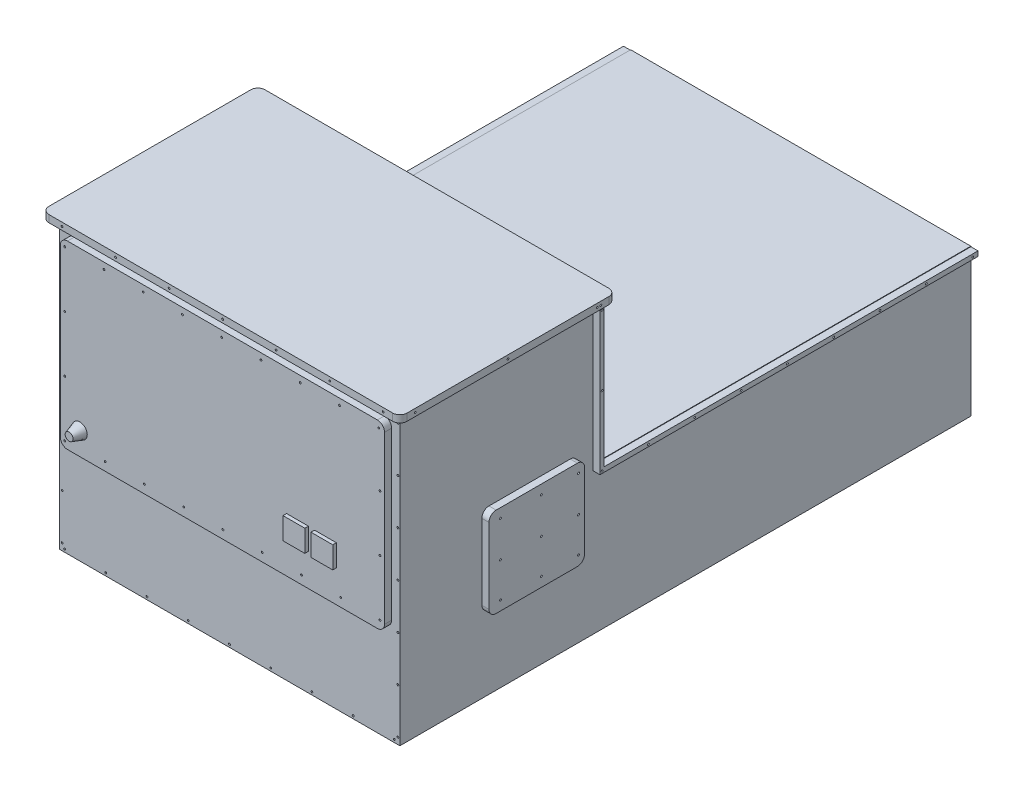
from build123d import *

# Parameters (mm, degrees)
SKETCH1_W                      = 95.34026147
SKETCH1_H                      = 41.254685336
BOSS_EXTRUDE1_DEPTH            = 160
SKETCH2_W                      = 95.34026147
SKETCH2_H                      = 55.558780076
BOSS_EXTRUDE2_DEPTH            = 40
BOSS_EXTRUDE3_DEPTH            = 2
LPATTERN1_COUNT                = 3
LPATTERN1_PITCH                = 19.5
LPATTERN1_COUNT_DIR2           = 10
LPATTERN1_PITCH_DIR2           = 12.98
F_0_80_TAPPED_HOLE3_AT_2_COUNT = 2
F_0_80_TAPPED_HOLE3_AT_2_PITCH = 19.810011741
F_0_80_TAPPED_HOLE3_AT_3_COUNT = 2
F_0_80_TAPPED_HOLE3_AT_3_PITCH = 22.382077827
F_0_80_TAPPED_HOLE3_AT_4_COUNT = 2
F_0_80_TAPPED_HOLE3_AT_4_PITCH = 29.500281021
F_0_80_TAPPED_HOLE3_AT_5_COUNT = 2
F_0_80_TAPPED_HOLE3_AT_5_PITCH = 24.069719456
F_0_80_TAPPED_HOLE3_AT_6_COUNT = 2
F_0_80_TAPPED_HOLE3_AT_6_PITCH = 21.8593233
F_0_80_TAPPED_HOLE3_AT_7_COUNT = 2
F_0_80_TAPPED_HOLE3_AT_7_PITCH = 14.492833478
F_0_80_TAPPED_HOLE3_AT_8_COUNT = 2
F_0_80_TAPPED_HOLE3_AT_8_PITCH = 10.075781834
F_0_80_TAPPED_HOLE3_AT_9_COUNT = 2
F_0_80_TAPPED_HOLE3_AT_9_PITCH = 10.41733376
BOSS_EXTRUDE4_DEPTH            = 1
BOSS_EXTRUDE4_DEPTH_BACK       = 1
LPATTERN2_COUNT                = 3
LPATTERN2_PITCH                = 26
LPATTERN3_COUNT                = 7
LPATTERN3_PITCH                = 15
LPATTERN5_COUNT                = 9
LPATTERN5_PITCH                = 11.55
LPATTERN6_COUNT                = 7
LPATTERN6_PITCH                = 12.7
LPATTERN7_COUNT                = 7
LPATTERN7_PITCH                = 12.7
BOSS_EXTRUDE5_DEPTH            = 2
LPATTERN8_COUNT                = 4
LPATTERN8_PITCH                = 15.7
LPATTERN8_COL_COUNT            = 9
LPATTERN8_COL_PITCH            = 11
LPATTERN10_COUNT               = 3
LPATTERN10_PITCH               = 15.7
LPATTERN10_COL_COUNT           = 8
LPATTERN10_COL_PITCH           = 11
LPATTERN11_COUNT               = 3
LPATTERN11_PITCH               = 26
SKETCH32_R                     = 2.087121455
BOSS_EXTRUDE6_DEPTH            = 3
BOSS_EXTRUDE6_TAPER            = 18
SKETCH33_W                     = 6.11625026
SKETCH33_H                     = 6.116250259
SKETCH33_W_2                   = 6.116250259
BOSS_EXTRUDE7_DEPTH            = 1


with BuildPart() as part:
    # Sketch1 → Boss-Extrude1 (new body)
    with BuildSketch(Plane.XY):
        Rectangle(SKETCH1_W, SKETCH1_H)
    extrude(amount=BOSS_EXTRUDE1_DEPTH)

    # Sketch2 → Boss-Extrude2 (add)
    with BuildSketch(Plane(origin=(0, 20.627342668, 0), x_dir=(1, 0, 0), z_dir=(0, 1, 0))):
        with Locations((0, -132.220609962)):
            Rectangle(SKETCH2_W, SKETCH2_H)
    extrude(amount=BOSS_EXTRUDE2_DEPTH)

    # Sketch3 → Boss-Extrude3 (add)
    with BuildSketch(Plane.ZY.offset(47.670130735)):
        Polygon((104.752478872, 20.48786272), (0, 20.48786272), (0, 19.127342668), (105.941219924, 19.127342668), (105.941219924, 60.627342668), (104.752478872, 60.627342668), align=None)
        with BuildLine():
            Line((135.031439918, 25.091802798), (112.251606798, 25.091802798))
            ThreePointArc((112.251606798, 25.091802798), (110.837393235, 24.506016361), (110.251606798, 23.091802798))
            Line((110.251606798, 23.091802798), (110.251606798, 2))
            ThreePointArc((110.251606798, 2), (110.837393235, 0.585786438), (112.251606798, 0))
            Line((112.251606798, 0), (135.031439918, 0))
            ThreePointArc((135.031439918, 0), (136.44565348, 0.585786438), (137.031439918, 2))
            Line((137.031439918, 2), (137.031439918, 23.091802798))
            ThreePointArc((137.031439918, 23.091802798), (136.44565348, 24.506016361), (135.031439918, 25.091802798))
        make_face()
    boss_extrude3 = extrude(amount=BOSS_EXTRUDE3_DEPTH)

    # Sketch8 → #0-80 Tapped Hole1 (revolve, cut)
    with BuildSketch(Plane(origin=(-49.670130735, 19.742612561, 1.487958011), x_dir=(0, 0, 1), z_dir=(0, 1, 0))):
        Polygon((0, 0), (0, 16.832618597), (0.254, 16.68), (0.254, 0), align=None)
    f_0_80_tapped_hole1 = revolve(axis=Axis((-56.020130735, 19.742612561, 1.487958011), (1, 0, 0)), mode=Mode.SUBTRACT)

    # LPattern1: 0-80 Tapped Hole1 3 × 10, 19 skipped
    with Locations(*[(0, i * LPATTERN1_PITCH, j * LPATTERN1_PITCH_DIR2) for i in range(LPATTERN1_COUNT) for j in range(LPATTERN1_COUNT_DIR2) if (i, j) not in ((0, 0), (0, 9), (1, 0), (1, 1), (1, 2), (1, 3), (1, 4), (1, 5), (1, 6), (1, 7), (1, 9), (2, 0), (2, 1), (2, 2), (2, 3), (2, 4), (2, 5), (2, 6), (2, 7), (2, 9))]):
        add(f_0_80_tapped_hole1, mode=Mode.SUBTRACT)

    # Sketch12 → #0-80 Tapped Hole3 (revolve, cut)
    with BuildSketch(Plane(origin=(-49.670130735, 22.476251468, 111.935105134), x_dir=(0, 0, 1), z_dir=(0, 1, 0))):
        Polygon((0, 0), (0, 16.832618597), (0.254, 16.68), (0.254, 0), align=None)
    f_0_80_tapped_hole3 = revolve(axis=Axis((-56.020130735, 22.476251468, 111.935105134), (1, 0, 0)), mode=Mode.SUBTRACT)

    # #0-80 Tapped Hole3 at 2: #0-80 Tapped Hole3 ×2
    with Locations(*[(0, -i * F_0_80_TAPPED_HOLE3_AT_2_PITCH, 0) for i in range(1, F_0_80_TAPPED_HOLE3_AT_2_COUNT)]):
        add(f_0_80_tapped_hole3, mode=Mode.SUBTRACT)

    # #0-80 Tapped Hole3 at 3: #0-80 Tapped Hole3 ×2
    with Locations(*[Vector(0, -0.8850836769550114, 0.46543193357116885) * (i * F_0_80_TAPPED_HOLE3_AT_3_PITCH) for i in range(1, F_0_80_TAPPED_HOLE3_AT_3_COUNT)]):
        add(f_0_80_tapped_hole3, mode=Mode.SUBTRACT)

    # #0-80 Tapped Hole3 at 4: #0-80 Tapped Hole3 ×2
    with Locations(*[Vector(0, -0.6715194247388597, 0.7409869514359825) * (i * F_0_80_TAPPED_HOLE3_AT_4_PITCH) for i in range(1, F_0_80_TAPPED_HOLE3_AT_4_COUNT)]):
        add(f_0_80_tapped_hole3, mode=Mode.SUBTRACT)

    # #0-80 Tapped Hole3 at 5: #0-80 Tapped Hole3 ×2
    with Locations(*[Vector(0, -0.41860819574565433, 0.9081669331431133) * (i * F_0_80_TAPPED_HOLE3_AT_5_PITCH) for i in range(1, F_0_80_TAPPED_HOLE3_AT_5_COUNT)]):
        add(f_0_80_tapped_hole3, mode=Mode.SUBTRACT)

    # #0-80 Tapped Hole3 at 6: #0-80 Tapped Hole3 ×2
    with Locations(*[(0, 0, i * F_0_80_TAPPED_HOLE3_AT_6_PITCH) for i in range(1, F_0_80_TAPPED_HOLE3_AT_6_COUNT)]):
        add(f_0_80_tapped_hole3, mode=Mode.SUBTRACT)

    # #0-80 Tapped Hole3 at 7: #0-80 Tapped Hole3 ×2
    with Locations(*[Vector(0, -0.6952251158274657, 0.718792068906361) * (i * F_0_80_TAPPED_HOLE3_AT_7_PITCH) for i in range(1, F_0_80_TAPPED_HOLE3_AT_7_COUNT)]):
        add(f_0_80_tapped_hole3, mode=Mode.SUBTRACT)

    # #0-80 Tapped Hole3 at 8: #0-80 Tapped Hole3 ×2
    with Locations(*[(0, -i * F_0_80_TAPPED_HOLE3_AT_8_PITCH, 0) for i in range(1, F_0_80_TAPPED_HOLE3_AT_8_COUNT)]):
        add(f_0_80_tapped_hole3, mode=Mode.SUBTRACT)

    # #0-80 Tapped Hole3 at 9: #0-80 Tapped Hole3 ×2
    with Locations(*[(0, 0, i * F_0_80_TAPPED_HOLE3_AT_9_PITCH) for i in range(1, F_0_80_TAPPED_HOLE3_AT_9_COUNT)]):
        add(f_0_80_tapped_hole3, mode=Mode.SUBTRACT)

    # Sketch13 → Boss-Extrude4 (add, two sides: drawn at the far end of the back side and taken through both)
    with BuildSketch(Plane(origin=(0, 60.627342668, 0), x_dir=(1, 0, 0), z_dir=(0, 1, 0)).offset(-BOSS_EXTRUDE4_DEPTH_BACK)):
        with BuildLine():
            Line((-48.170130735, -101.941219924), (48.170130735, -101.941219924))
            ThreePointArc((48.170130735, -101.941219924), (49.584344297, -102.527006361), (50.170130735, -103.941219924))
            Line((50.170130735, -103.941219924), (50.170130735, -160.5))
            ThreePointArc((50.170130735, -160.5), (49.584344297, -161.914213562), (48.170130735, -162.5))
            Line((48.170130735, -162.5), (-48.170130735, -162.5))
            ThreePointArc((-48.170130735, -162.5), (-49.584344297, -161.914213562), (-50.170130735, -160.5))
            Line((-50.170130735, -160.5), (-50.170130735, -103.941219924))
            ThreePointArc((-50.170130735, -103.941219924), (-49.584344297, -102.527006361), (-48.170130735, -101.941219924))
        make_face()
    extrude(amount=BOSS_EXTRUDE4_DEPTH + BOSS_EXTRUDE4_DEPTH_BACK)

    # Sketch18 → #0-80 Tapped Hole4 (revolve, cut)
    with BuildSketch(Plane(origin=(-50.170130735, 60.592369022, 107.206095587), x_dir=(0, 0, 1), z_dir=(0, 1, 0))):
        Polygon((0, 0), (0, 16.832618597), (0.254, 16.68), (0.254, 0), align=None)
    f_0_80_tapped_hole4 = revolve(axis=Axis((-56.520130735, 60.592369022, 107.206095587), (1, 0, 0)), mode=Mode.SUBTRACT)

    # LPattern2: #0-80 Tapped Hole4 ×3
    with Locations(*[(0, 0, i * LPATTERN2_PITCH) for i in range(1, LPATTERN2_COUNT)]):
        add(f_0_80_tapped_hole4, mode=Mode.SUBTRACT)

    # Sketch19 → #0-80 Tapped Hole5 (revolve, cut)
    with BuildSketch(Plane(origin=(-44.508437836, 60.575463395, 162.5), x_dir=(0, -1, 0), z_dir=(1, 0, 0))):
        Polygon((0, 0), (0, 16.832618597), (0.254, 16.68), (0.254, 0), align=None)
    f_0_80_tapped_hole5 = revolve(axis=Axis((-44.508437836, 60.575463395, 168.85), (0, 0, -1)), mode=Mode.SUBTRACT)

    # LPattern3: #0-80 Tapped Hole5 ×7
    with Locations(*[(i * LPATTERN3_PITCH, 0, 0) for i in range(1, LPATTERN3_COUNT)]):
        add(f_0_80_tapped_hole5, mode=Mode.SUBTRACT)

    # Sketch21 → #0-80 Tapped Hole7 (revolve, cut)
    with BuildSketch(Plane(origin=(-46.277708656, -19.855081426, 160), x_dir=(0, -1, 0), z_dir=(1, 0, 0))):
        Polygon((0, 0), (0, 16.832618597), (0.254, 16.68), (0.254, 0), align=None)
    f_0_80_tapped_hole7 = revolve(axis=Axis((-46.277708656, -19.855081426, 166.35), (0, 0, -1)), mode=Mode.SUBTRACT)

    # LPattern5: #0-80 Tapped Hole7 ×9
    with Locations(*[(i * LPATTERN5_PITCH, 0, 0) for i in range(1, LPATTERN5_COUNT)]):
        add(f_0_80_tapped_hole7, mode=Mode.SUBTRACT)

    # Sketch23 → #0-80 Tapped Hole8 (revolve, cut)
    with BuildSketch(Plane(origin=(-46.95253564, -18.666510899, 160), x_dir=(0, -1, 0), z_dir=(1, 0, 0))):
        Polygon((0, 0), (0, 16.832618597), (0.254, 16.68), (0.254, 0), align=None)
    f_0_80_tapped_hole8 = revolve(axis=Axis((-46.95253564, -18.666510899, 166.35), (0, 0, -1)), mode=Mode.SUBTRACT)

    # LPattern6: #0-80 Tapped Hole8 ×7
    with Locations(*[(0, i * LPATTERN6_PITCH, 0) for i in range(1, LPATTERN6_COUNT)]):
        add(f_0_80_tapped_hole8, mode=Mode.SUBTRACT)

    # Sketch24 → #0-80 Tapped Hole9 (revolve, cut)
    with BuildSketch(Plane(origin=(47.112031618, -18.805775391, 160), x_dir=(0, -1, 0), z_dir=(1, 0, 0))):
        Polygon((0, 0), (0, 16.832618597), (0.254, 16.68), (0.254, 0), align=None)
    f_0_80_tapped_hole9 = revolve(axis=Axis((47.112031618, -18.805775391, 166.35), (0, 0, -1)), mode=Mode.SUBTRACT)

    # LPattern7: #0-80 Tapped Hole9 ×7
    with Locations(*[(0, i * LPATTERN7_PITCH, 0) for i in range(1, LPATTERN7_COUNT)]):
        add(f_0_80_tapped_hole9, mode=Mode.SUBTRACT)

    # Sketch25 → Boss-Extrude5 (add)
    with BuildSketch(Plane.XY.offset(160)):
        with BuildLine():
            Line((-43.47136272, 57.302361913), (43.362318684, 57.302361913))
            ThreePointArc((43.362318684, 57.302361913), (44.776532247, 56.716575476), (45.362318684, 55.302361913))
            Line((45.362318684, 55.302361913), (45.362318684, 8.705929535))
            ThreePointArc((45.362318684, 8.705929535), (44.776532247, 7.291715972), (43.362318684, 6.705929535))
            Line((43.362318684, 6.705929535), (-43.47136272, 6.705929535))
            ThreePointArc((-43.47136272, 6.705929535), (-44.885576282, 7.291715972), (-45.47136272, 8.705929535))
            Line((-45.47136272, 8.705929535), (-45.47136272, 55.302361913))
            ThreePointArc((-45.47136272, 55.302361913), (-44.885576282, 56.716575476), (-43.47136272, 57.302361913))
        make_face()
    extrude(amount=BOSS_EXTRUDE5_DEPTH)

    # Sketch26 → #0-80 Tapped Hole10 (revolve, cut)
    with BuildSketch(Plane(origin=(-44.2601076, 55.525095364, 162), x_dir=(0, -1, 0), z_dir=(1, 0, 0))):
        Polygon((0, 0), (0, 16.832618597), (0.254, 16.68), (0.254, 0), align=None)
    f_0_80_tapped_hole10 = revolve(axis=Axis((-44.2601076, 55.525095364, 168.35), (0, 0, -1)), mode=Mode.SUBTRACT)

    # LPattern8: #0-80 Tapped Hole10 ×4
    with Locations(*[(0, -i * LPATTERN8_PITCH, 0) for i in range(1, LPATTERN8_COUNT)]):
        add(f_0_80_tapped_hole10, mode=Mode.SUBTRACT)

    # LPattern8 col: #0-80 Tapped Hole10 ×9
    with Locations(*[(i * LPATTERN8_COL_PITCH, 0, 0) for i in range(1, LPATTERN8_COL_COUNT)]):
        add(f_0_80_tapped_hole10, mode=Mode.SUBTRACT)

    # Sketch30 → #0-80 Tapped Hole11 (revolve, cut)
    with BuildSketch(Plane(origin=(44.087316191, 9.051962039, 162), x_dir=(0, -1, 0), z_dir=(1, 0, 0))):
        Polygon((0, 0), (0, 16.832618597), (0.254, 16.68), (0.254, 0), align=None)
    f_0_80_tapped_hole11 = revolve(axis=Axis((44.087316191, 9.051962039, 168.35), (0, 0, -1)), mode=Mode.SUBTRACT)

    # LPattern10: #0-80 Tapped Hole11 ×3
    with Locations(*[(0, i * LPATTERN10_PITCH, 0) for i in range(1, LPATTERN10_COUNT)]):
        add(f_0_80_tapped_hole11, mode=Mode.SUBTRACT)

    # LPattern10 col: #0-80 Tapped Hole11 ×8
    with Locations(*[(-i * LPATTERN10_COL_PITCH, 0, 0) for i in range(1, LPATTERN10_COL_COUNT)]):
        add(f_0_80_tapped_hole11, mode=Mode.SUBTRACT)

    # Sketch31 → #0-80 Tapped Hole12 (revolve, cut)
    with BuildSketch(Plane(origin=(50.170130735, 60.606748013, 158.184732794), x_dir=(0, 0, -1), z_dir=(0, 1, 0))):
        Polygon((0, 0), (0, 16.832618597), (0.254, 16.68), (0.254, 0), align=None)
    f_0_80_tapped_hole12 = revolve(axis=Axis((56.520130735, 60.606748013, 158.184732794), (-1, 0, 0)), mode=Mode.SUBTRACT)

    # LPattern11: #0-80 Tapped Hole12 ×3
    with Locations(*[(0, 0, -i * LPATTERN11_PITCH) for i in range(1, LPATTERN11_COUNT)]):
        add(f_0_80_tapped_hole12, mode=Mode.SUBTRACT)

    # Mirror3: Boss-Extrude3, #0-80 Tapped Hole1, #0-80 Tapped Hole3, #0-80 Tapped Hole4 across plane
    add(boss_extrude3.mirror(Plane(origin=(0, 0, 0), x_dir=(0, 0, 1), z_dir=(1, 0, 0))))
    add(f_0_80_tapped_hole1.mirror(Plane(origin=(0, 0, 0), x_dir=(0, 0, 1), z_dir=(1, 0, 0))), mode=Mode.SUBTRACT)
    add(f_0_80_tapped_hole3.mirror(Plane(origin=(0, 0, 0), x_dir=(0, 0, 1), z_dir=(1, 0, 0))), mode=Mode.SUBTRACT)
    add(f_0_80_tapped_hole4.mirror(Plane(origin=(0, 0, 0), x_dir=(0, 0, 1), z_dir=(1, 0, 0))), mode=Mode.SUBTRACT)

    # Mirror3 copy 1 sketch → Mirror3 copy 1 (revolve, cut)
    with BuildSketch(Plane(origin=(49.670130735, 19.742612561, 14.467958011), x_dir=(0, 0, 1), z_dir=(0, 1, 0))):
        Polygon((0, 0), (0, -16.832618597), (0.254, -16.68), (0.254, 0), align=None)
    revolve(axis=Axis((56.020130735, 19.742612561, 14.467958011), (1, 0, 0)), mode=Mode.SUBTRACT)

    # Mirror3 copy 2 sketch → Mirror3 copy 2 (revolve, cut)
    with BuildSketch(Plane(origin=(49.670130735, 19.742612561, 27.447958011), x_dir=(0, 0, 1), z_dir=(0, 1, 0))):
        Polygon((0, 0), (0, -16.832618597), (0.254, -16.68), (0.254, 0), align=None)
    revolve(axis=Axis((56.020130735, 19.742612561, 27.447958011), (1, 0, 0)), mode=Mode.SUBTRACT)

    # Mirror3 copy 3 sketch → Mirror3 copy 3 (revolve, cut)
    with BuildSketch(Plane(origin=(49.670130735, 19.742612561, 40.427958011), x_dir=(0, 0, 1), z_dir=(0, 1, 0))):
        Polygon((0, 0), (0, -16.832618597), (0.254, -16.68), (0.254, 0), align=None)
    revolve(axis=Axis((56.020130735, 19.742612561, 40.427958011), (1, 0, 0)), mode=Mode.SUBTRACT)

    # Mirror3 copy 4 sketch → Mirror3 copy 4 (revolve, cut)
    with BuildSketch(Plane(origin=(49.670130735, 19.742612561, 53.407958011), x_dir=(0, 0, 1), z_dir=(0, 1, 0))):
        Polygon((0, 0), (0, -16.832618597), (0.254, -16.68), (0.254, 0), align=None)
    revolve(axis=Axis((56.020130735, 19.742612561, 53.407958011), (1, 0, 0)), mode=Mode.SUBTRACT)

    # Mirror3 copy 5 sketch → Mirror3 copy 5 (revolve, cut)
    with BuildSketch(Plane(origin=(49.670130735, 19.742612561, 66.387958011), x_dir=(0, 0, 1), z_dir=(0, 1, 0))):
        Polygon((0, 0), (0, -16.832618597), (0.254, -16.68), (0.254, 0), align=None)
    revolve(axis=Axis((56.020130735, 19.742612561, 66.387958011), (1, 0, 0)), mode=Mode.SUBTRACT)

    # Mirror3 copy 6 sketch → Mirror3 copy 6 (revolve, cut)
    with BuildSketch(Plane(origin=(49.670130735, 19.742612561, 79.367958011), x_dir=(0, 0, 1), z_dir=(0, 1, 0))):
        Polygon((0, 0), (0, -16.832618597), (0.254, -16.68), (0.254, 0), align=None)
    revolve(axis=Axis((56.020130735, 19.742612561, 79.367958011), (1, 0, 0)), mode=Mode.SUBTRACT)

    # Mirror3 copy 7 sketch → Mirror3 copy 7 (revolve, cut)
    with BuildSketch(Plane(origin=(49.670130735, 19.742612561, 92.347958011), x_dir=(0, 0, 1), z_dir=(0, 1, 0))):
        Polygon((0, 0), (0, -16.832618597), (0.254, -16.68), (0.254, 0), align=None)
    revolve(axis=Axis((56.020130735, 19.742612561, 92.347958011), (1, 0, 0)), mode=Mode.SUBTRACT)

    # Mirror3 copy 8 sketch → Mirror3 copy 8 (revolve, cut)
    with BuildSketch(Plane(origin=(49.670130735, 19.742612561, 105.327958011), x_dir=(0, 0, 1), z_dir=(0, 1, 0))):
        Polygon((0, 0), (0, -16.832618597), (0.254, -16.68), (0.254, 0), align=None)
    revolve(axis=Axis((56.020130735, 19.742612561, 105.327958011), (1, 0, 0)), mode=Mode.SUBTRACT)

    # Mirror3 copy 9 sketch → Mirror3 copy 9 (revolve, cut)
    with BuildSketch(Plane(origin=(49.670130735, 39.242612561, 105.327958011), x_dir=(0, 0, 1), z_dir=(0, 1, 0))):
        Polygon((0, 0), (0, -16.832618597), (0.254, -16.68), (0.254, 0), align=None)
    revolve(axis=Axis((56.020130735, 39.242612561, 105.327958011), (1, 0, 0)), mode=Mode.SUBTRACT)

    # Mirror3 copy 10 sketch → Mirror3 copy 10 (revolve, cut)
    with BuildSketch(Plane(origin=(49.670130735, 58.742612561, 105.327958011), x_dir=(0, 0, 1), z_dir=(0, 1, 0))):
        Polygon((0, 0), (0, -16.832618597), (0.254, -16.68), (0.254, 0), align=None)
    revolve(axis=Axis((56.020130735, 58.742612561, 105.327958011), (1, 0, 0)), mode=Mode.SUBTRACT)

    # Mirror3 copy 11 sketch → Mirror3 copy 11 (revolve, cut)
    with BuildSketch(Plane(origin=(49.670130735, 2.666239727, 111.935105134), x_dir=(0, 0, 1), z_dir=(0, 1, 0))):
        Polygon((0, 0), (0, -16.832618597), (0.254, -16.68), (0.254, 0), align=None)
    revolve(axis=Axis((56.020130735, 2.666239727, 111.935105134), (1, 0, 0)), mode=Mode.SUBTRACT)

    # Mirror3 copy 12 sketch → Mirror3 copy 12 (revolve, cut)
    with BuildSketch(Plane(origin=(49.670130735, 2.666239727, 122.352438894), x_dir=(0, 0, 1), z_dir=(0, 1, 0))):
        Polygon((0, 0), (0, -16.832618597), (0.254, -16.68), (0.254, 0), align=None)
    revolve(axis=Axis((56.020130735, 2.666239727, 122.352438894), (1, 0, 0)), mode=Mode.SUBTRACT)

    # Mirror3 copy 13 sketch → Mirror3 copy 13 (revolve, cut)
    with BuildSketch(Plane(origin=(49.670130735, 2.666239727, 133.794428434), x_dir=(0, 0, 1), z_dir=(0, 1, 0))):
        Polygon((0, 0), (0, -16.832618597), (0.254, -16.68), (0.254, 0), align=None)
    revolve(axis=Axis((56.020130735, 2.666239727, 133.794428434), (1, 0, 0)), mode=Mode.SUBTRACT)

    # Mirror3 copy 14 sketch → Mirror3 copy 14 (revolve, cut)
    with BuildSketch(Plane(origin=(49.670130735, 12.400469634, 133.794428434), x_dir=(0, 0, 1), z_dir=(0, 1, 0))):
        Polygon((0, 0), (0, -16.832618597), (0.254, -16.68), (0.254, 0), align=None)
    revolve(axis=Axis((56.020130735, 12.400469634, 133.794428434), (1, 0, 0)), mode=Mode.SUBTRACT)

    # Mirror3 copy 15 sketch → Mirror3 copy 15 (revolve, cut)
    with BuildSketch(Plane(origin=(49.670130735, 22.476251468, 133.794428434), x_dir=(0, 0, 1), z_dir=(0, 1, 0))):
        Polygon((0, 0), (0, -16.832618597), (0.254, -16.68), (0.254, 0), align=None)
    revolve(axis=Axis((56.020130735, 22.476251468, 133.794428434), (1, 0, 0)), mode=Mode.SUBTRACT)

    # Mirror3 copy 16 sketch → Mirror3 copy 16 (revolve, cut)
    with BuildSketch(Plane(origin=(49.670130735, 12.400469634, 122.352438894), x_dir=(0, 0, 1), z_dir=(0, 1, 0))):
        Polygon((0, 0), (0, -16.832618597), (0.254, -16.68), (0.254, 0), align=None)
    revolve(axis=Axis((56.020130735, 12.400469634, 122.352438894), (1, 0, 0)), mode=Mode.SUBTRACT)

    # Mirror3 copy 17 sketch → Mirror3 copy 17 (revolve, cut)
    with BuildSketch(Plane(origin=(49.670130735, 12.400469634, 111.935105134), x_dir=(0, 0, 1), z_dir=(0, 1, 0))):
        Polygon((0, 0), (0, -16.832618597), (0.254, -16.68), (0.254, 0), align=None)
    revolve(axis=Axis((56.020130735, 12.400469634, 111.935105134), (1, 0, 0)), mode=Mode.SUBTRACT)

    # Mirror3 copy 18 sketch → Mirror3 copy 18 (revolve, cut)
    with BuildSketch(Plane(origin=(49.670130735, 22.476251468, 122.352438894), x_dir=(0, 0, 1), z_dir=(0, 1, 0))):
        Polygon((0, 0), (0, -16.832618597), (0.254, -16.68), (0.254, 0), align=None)
    revolve(axis=Axis((56.020130735, 22.476251468, 122.352438894), (1, 0, 0)), mode=Mode.SUBTRACT)

    # Sketch32 → Boss-Extrude6 (add)
    with BuildSketch(Plane.XY.offset(162)):
        with Locations((-40.01459246, 13.050563064)):
            Circle(SKETCH32_R)
    extrude(amount=BOSS_EXTRUDE6_DEPTH, taper=BOSS_EXTRUDE6_TAPER)

    # Sketch33 → Boss-Extrude7 (add)
    with BuildSketch(Plane.XY.offset(162)):
        with Locations((20.970000889, 18.807109303)):
            Rectangle(SKETCH33_W, SKETCH33_H)
        with Locations((28.801788053, 18.697884339)):
            Rectangle(SKETCH33_W_2, SKETCH33_H)
    extrude(amount=BOSS_EXTRUDE7_DEPTH)


solid = part.part
